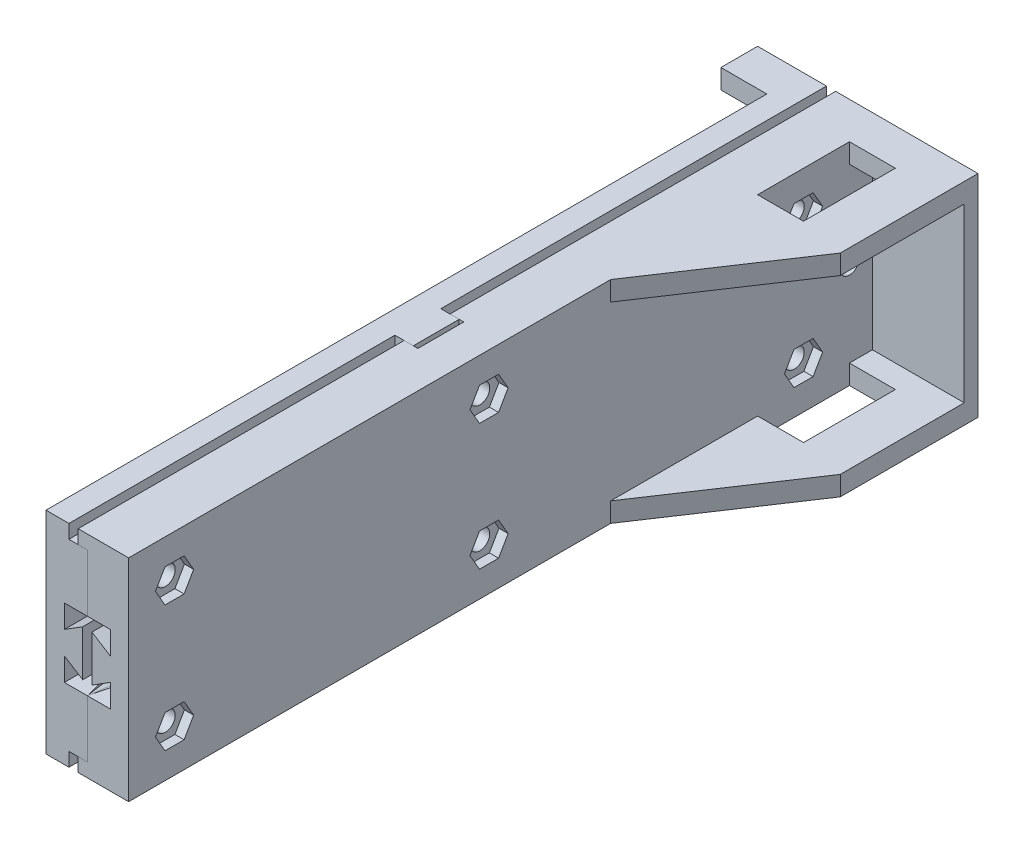
from build123d import *

# Parameters (mm, degrees)
SKETCH1_W                = 152
SKETCH1_H                = 15
BOSS_EXTRUDE1_DEPTH      = 1
SKETCH2_W                = 20
SKETCH2_H                = 15
BOSS_EXTRUDE2_DEPTH      = 4
CUT_EXTRUDE1_DEPTH       = 133.3074072
MIRROR2_COPY_1_SKETCH_W  = 20
MIRROR2_COPY_1_SKETCH_H  = 15
MIRROR2_COPY_1_DEPTH     = 4
MIRROR2_COPY_2_DEPTH     = 133.3074072
BOSS_EXTRUDE5_DEPTH      = 2.5
CUT_EXTRUDE2_DEPTH       = 78.30459236
SKETCH9_R                = 0.75
CUT_EXTRUDE3_DEPTH       = 153.410629551
CUT_EXTRUDE4_DEPTH       = 153.410629551
BOSS_EXTRUDE6_DEPTH      = 4
BOSS_EXTRUDE6_DEPTH_BACK = 14
SKETCH11_W               = 162
SKETCH11_H               = 40
BOSS_EXTRUDE7_DEPTH      = 11
BOSS_EXTRUDE8_DEPTH      = 5
SKETCH14_W               = 10
SKETCH14_H               = 3
BOSS_EXTRUDE9_DEPTH      = 4
SKETCH15_W               = 10
SKETCH15_H               = 3
CUT_EXTRUDE5_DEPTH       = 3
SKETCH16_R               = 2.15
CUT_EXTRUDE6_DEPTH       = 94.669632219
SKETCH18_R               = 1
CUT_EXTRUDE7_DEPTH       = 93.466210045
SKETCH19_R               = 3.5
SKETCH19_R_2             = 1
CUT_EXTRUDE8_DEPTH       = 2
SKETCH20_R               = 5.5
SKETCH20_R_2             = 3.5
BOSS_EXTRUDE10_DEPTH     = 2
BOSS_EXTRUDE11_DEPTH     = 20
CUT_EXTRUDE9_DEPTH       = 105.29765098
SKETCH24_W               = 20
SKETCH24_H               = 46
CUT_EXTRUDE10_DEPTH      = 10
CUT_EXTRUDE11_DEPTH      = 2
SKETCH26_W               = 8
SKETCH26_H               = 4.25
BOSS_EXTRUDE12_DEPTH     = 10


with BuildPart() as part:
    # Sketch1 → Boss-Extrude1 (new, symmetric)
    with BuildSketch(Plane(origin=(0, 0, 0), x_dir=(0, 0, -1), z_dir=(1, 0, 0))):
        Rectangle(SKETCH1_W, SKETCH1_H)
    extrude(amount=BOSS_EXTRUDE1_DEPTH, both=True)

    # Sketch2 → Boss-Extrude2 (add)
    with BuildSketch(Plane(origin=(1, 0, 0), x_dir=(0, 0, -1), z_dir=(1, 0, 0))):
        with Locations((66, 0)):
            Rectangle(SKETCH2_W, SKETCH2_H)
    boss_extrude2 = extrude(amount=BOSS_EXTRUDE2_DEPTH)

    # Sketch3 → Cut-Extrude1 (cut, through all)
    with BuildSketch(Plane.XY.offset(-56)):
        Polygon((5, 2.5), (1, 5), (1, -5), (5, -2.5), align=None)
    cut_extrude1 = extrude(amount=-CUT_EXTRUDE1_DEPTH, mode=Mode.SUBTRACT)

    # Mirror1: Boss-Extrude2, Cut-Extrude1 across plane
    add(boss_extrude2.mirror(Plane(origin=(0, 0, 0), x_dir=(0, 0, 1), z_dir=(1, 0, 0))))
    add(cut_extrude1.mirror(Plane(origin=(0, 0, 0), x_dir=(0, 0, 1), z_dir=(1, 0, 0))), mode=Mode.SUBTRACT)

    # Mirror2: Boss-Extrude2, Cut-Extrude1 across plane
    add(boss_extrude2.mirror(Plane.XY))
    add(cut_extrude1.mirror(Plane.XY), mode=Mode.SUBTRACT)

    # Mirror2 copy 1 sketch → Mirror2 copy 1 (add)
    with BuildSketch(Plane.ZY.offset(1)):
        with Locations((66, 0)):
            Rectangle(MIRROR2_COPY_1_SKETCH_W, MIRROR2_COPY_1_SKETCH_H)
    extrude(amount=MIRROR2_COPY_1_DEPTH)

    # Mirror2 copy 2 sketch → Mirror2 copy 2 (cut, through all)
    with BuildSketch(Plane(origin=(0, 0, 56), x_dir=(-1, 0, 0), z_dir=(0, 0, -1))):
        Polygon((5, 2.5), (1, 5), (1, -5), (5, -2.5), align=None)
    extrude(amount=-MIRROR2_COPY_2_DEPTH, mode=Mode.SUBTRACT)

    # Sketch7 → Boss-Extrude5 (add)
    with BuildSketch(Plane(origin=(0, 7.5, 0), x_dir=(1, 0, 0), z_dir=(0, 1, 0))):
        Polygon((0, -76), (-5, -56), (-5, 56), (0, 76), (5, 56), (5, -56), align=None)
    boss_extrude5 = extrude(amount=BOSS_EXTRUDE5_DEPTH)

    # Sketch8 → Cut-Extrude2 (cut, through all)
    with BuildSketch(Plane.ZY.offset(5)):
        Polygon((-56, 10), (-76, 7.5), (-76, 10), align=None)
        Polygon((76, 10), (56, 10), (76, 7.5), align=None)
    cut_extrude2 = extrude(amount=-CUT_EXTRUDE2_DEPTH, mode=Mode.SUBTRACT)

    # Sketch9 → Cut-Extrude3 (cut, through all)
    with BuildSketch(Plane.XY.offset(76)):
        with Locations((1.2, 9.7)):
            Circle(SKETCH9_R)
        with Locations((-1.2, 9.7)):
            Circle(SKETCH9_R)
    cut_extrude3 = extrude(amount=-CUT_EXTRUDE3_DEPTH, mode=Mode.SUBTRACT)

    # Mirror4: Boss-Extrude5, Cut-Extrude2, Cut-Extrude3 across plane
    add(boss_extrude5.mirror(Plane.ZX))
    add(cut_extrude2.mirror(Plane.ZX), mode=Mode.SUBTRACT)
    add(cut_extrude3.mirror(Plane.ZX), mode=Mode.SUBTRACT)

    # Sketch10 → Cut-Extrude4 (cut, through all)
    with BuildSketch(Plane(origin=(0, 0, -76), x_dir=(-1, 0, 0), z_dir=(0, 0, -1))):
        Polygon((-5, 8.5), (-3.2, 10), (-5, 10), align=None)
        Polygon((5, 10), (5, 8.5), (3.2, 10), align=None)
        Polygon((-5, -10), (-5, -8.5), (-3.2, -10), align=None)
        Polygon((5, -8.5), (3.2, -10), (5, -10), align=None)
    extrude(amount=-CUT_EXTRUDE4_DEPTH, mode=Mode.SUBTRACT)


with BuildPart() as body_2:
    # Sketch11 → Boss-Extrude6 (new, two sides: drawn at the far end of the back side and taken through both)
    with BuildSketch(Plane.ZY.offset(5).offset(-BOSS_EXTRUDE6_DEPTH_BACK)):
        with Locations((-5, 0)):
            Rectangle(SKETCH11_W, SKETCH11_H)
    extrude(amount=BOSS_EXTRUDE6_DEPTH + BOSS_EXTRUDE6_DEPTH_BACK)

    # Combine1: cut part
    add(part.part, mode=Mode.SUBTRACT)


with BuildPart() as body_2_2:
    # Split1: the piece on the far side of the plane
    add(body_2.part)
    split(bisect_by=Plane(origin=(0, 0, 0), x_dir=(0, 0, 1), z_dir=(1, 0, 0)), keep=Keep.BOTTOM)

    # Sketch13 → Boss-Extrude8 (add)
    with BuildSketch(Plane.ZY.offset(9)):
        Polygon((76, 23), (-89, 23), (-89, -23), (76, -23), (76, -20), (-86, -20), (-86, 20), (76, 20), align=None)
    extrude(amount=-BOSS_EXTRUDE8_DEPTH)

    # Sketch14 → Boss-Extrude9 (add)
    with BuildSketch(Plane(origin=(-4, 0, 0), x_dir=(0, 0, -1), z_dir=(1, 0, 0))):
        with Locations((0, 21.5)):
            Rectangle(SKETCH14_W, SKETCH14_H)
        with Locations((0, -21.5)):
            Rectangle(SKETCH14_W, SKETCH14_H)
    extrude(amount=BOSS_EXTRUDE9_DEPTH)


with BuildPart() as body_2_1:
    add(body_2.part)

    # Split1
    split(bisect_by=Plane(origin=(0, 0, 0), x_dir=(0, 0, 1), z_dir=(1, 0, 0)), keep=Keep.TOP)

    # Sketch12 → Boss-Extrude7 (add)
    with BuildSketch(Plane(origin=(9, 0, 0), x_dir=(0, 0, -1), z_dir=(1, 0, 0))):
        Polygon((-76, -20), (-76, -23), (89, -23), (89, 23), (-76, 23), (-76, 20), (86, 20), (86, -20), align=None)
    extrude(amount=-BOSS_EXTRUDE7_DEPTH)

    # Sketch15 → Cut-Extrude5 (cut)
    with BuildSketch(Plane.ZY.offset(2)):
        with Locations((0, -21.5)):
            Rectangle(SKETCH15_W, SKETCH15_H)
        with Locations((0, 21.5)):
            Rectangle(SKETCH15_W, SKETCH15_H)
    extrude(amount=-CUT_EXTRUDE5_DEPTH, mode=Mode.SUBTRACT)


with BuildPart() as cut_extrude6_tool:
    # Sketch16 → Cut-Extrude6 (new, through all)
    with BuildSketch(Plane.ZY.offset(9)):
        with Locations((-81, 0)):
            Circle(SKETCH16_R)
        with Locations((66, -13.75)):
            Circle(SKETCH16_R)
        with Locations((-71, -13.75)):
            Circle(SKETCH16_R)
        with Locations((-2.5, -13.75)):
            Circle(SKETCH16_R)
        with Locations(Location((-71, 13.75, 0), (0, 0, 180))):
            Circle(SKETCH16_R)
        with Locations(Location((-2.5, 13.75, 0), (0, 0, 180))):
            Circle(SKETCH16_R)
        with Locations(Location((66, 13.75, 0), (0, 0, 180))):
            Circle(SKETCH16_R)
    extrude(amount=-CUT_EXTRUDE6_DEPTH)


with BuildPart() as body_2_3:
    add(body_2_1.part)

    # Cut-Extrude6: cut by cut_extrude6_tool
    add(cut_extrude6_tool.part, mode=Mode.SUBTRACT)

    # Sketch22 → Boss-Extrude11 (add)
    with BuildSketch(Plane(origin=(9, 0, 0), x_dir=(0, 0, -1), z_dir=(1, 0, 0))):
        Polygon((29, -23), (29, -18.75), (86, -18.75), (86, 18.75), (29, 18.75), (29, 23), (89, 23), (89, -23), align=None)
    extrude(amount=BOSS_EXTRUDE11_DEPTH)

    # Sketch23 → Cut-Extrude9 (cut, through all)
    with BuildSketch(Plane.XZ.offset(23)):
        Polygon((29, -29), (9, -29), (29, -59), align=None)
    extrude(amount=-CUT_EXTRUDE9_DEPTH, mode=Mode.SUBTRACT)

    # Sketch24 → Cut-Extrude10 (cut)
    with BuildSketch(Plane(origin=(9, 0, 0), x_dir=(0, 0, -1), z_dir=(1, 0, 0))):
        with Locations((71, 0)):
            Rectangle(SKETCH24_W, SKETCH24_H)
    extrude(amount=CUT_EXTRUDE10_DEPTH, mode=Mode.SUBTRACT)

    # Sketch25 → Cut-Extrude11 (cut)
    with BuildSketch(Plane(origin=(9, 0, 0), x_dir=(0, 0, -1), z_dir=(1, 0, 0))):
        Polygon((73.078460969, -10.15), (68.921539031, -10.15), (66.843078062, -13.75), (68.921539031, -17.35), (73.078460969, -17.35), (75.156921938, -13.75), align=None)
        Polygon((4.578460969, -10.15), (0.421539031, -10.15), (-1.656921938, -13.75), (0.421539031, -17.35), (4.578460969, -17.35), (6.656921938, -13.75), align=None)
        Polygon((-63.921539031, -10.15), (-68.078460969, -10.15), (-70.156921938, -13.75), (-68.078460969, -17.35), (-63.921539031, -17.35), (-61.843078062, -13.75), align=None)
        Polygon((4.578460969, 17.35), (0.421539031, 17.35), (-1.656921938, 13.75), (0.421539031, 10.15), (4.578460969, 10.15), (6.656921938, 13.75), align=None)
        Polygon((-63.921539031, 17.35), (-68.078460969, 17.35), (-70.156921938, 13.75), (-68.078460969, 10.15), (-63.921539031, 10.15), (-61.843078062, 13.75), align=None)
        Polygon((73.078460969, 17.35), (68.921539031, 17.35), (66.843078062, 13.75), (68.921539031, 10.15), (73.078460969, 10.15), (75.156921938, 13.75), align=None)
    extrude(amount=-CUT_EXTRUDE11_DEPTH, mode=Mode.SUBTRACT)


with BuildPart() as body_2_2_1:
    add(body_2_2.part)

    # Cut-Extrude6: cut by cut_extrude6_tool
    add(cut_extrude6_tool.part, mode=Mode.SUBTRACT)

    # Sketch18 → Cut-Extrude7 (cut, through all)
    with BuildSketch(Plane(origin=(-1, 0, 0), x_dir=(0, 0, -1), z_dir=(1, 0, 0))):
        with Locations((71, 0)):
            Circle(SKETCH18_R)
    extrude(amount=-CUT_EXTRUDE7_DEPTH, mode=Mode.SUBTRACT)

    # Sketch19 → Cut-Extrude8 (cut)
    with BuildSketch(Plane.ZY.offset(9)):
        with Locations((-71, 0)):
            Circle(SKETCH19_R)
        with Locations(Location((-71, 0, 0), (0, 0, 180))):
            Circle(SKETCH19_R_2, mode=Mode.SUBTRACT)
    extrude(amount=-CUT_EXTRUDE8_DEPTH, mode=Mode.SUBTRACT)

    # Sketch20 → Boss-Extrude10 (add)
    with BuildSketch(Plane.ZY.offset(9)):
        with Locations((-71, 0)):
            Circle(SKETCH20_R)
        with Locations((-71, 0)):
            Circle(SKETCH20_R_2, mode=Mode.SUBTRACT)
    extrude(amount=BOSS_EXTRUDE10_DEPTH)

    # Sketch26 → Boss-Extrude12 (add)
    with BuildSketch(Plane.ZY.offset(9)):
        with Locations((-85, 20.875)):
            Rectangle(SKETCH26_W, SKETCH26_H)
        with Locations((-85, -20.875)):
            Rectangle(SKETCH26_W, SKETCH26_H)
    extrude(amount=BOSS_EXTRUDE12_DEPTH)


solid = Compound([body_2_3.part, body_2_2_1.part])
